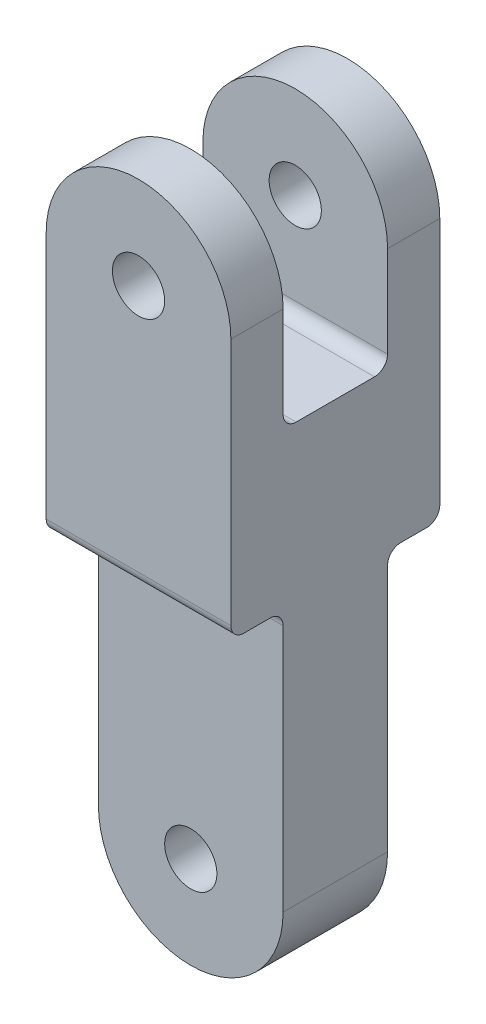
from build123d import *

# Parameters (mm, degrees)
BOSS_EXTRUDE1_DEPTH      = 40
BOSS_EXTRUDE1_DEPTH_BACK = 40
SKETCH1_R                = 10
CUT_EXTRUDE2_DEPTH       = 20
CUT_EXTRUDE2_DEPTH_BACK  = 20
CUT_EXTRUDE4_START       = -20
CUT_EXTRUDE4_DEPTH       = 20
CUT_EXTRUDE6_START       = -20
CUT_EXTRUDE6_DEPTH       = 20
FILLET3_R                = 5
SHELL1_START             = -15
SHELL1_OUTLINE_R         = 15
SHELL1_DEPTH             = 30
SHELL1_START_2           = -35
SHELL1_2_OUTLINE_W       = 60.710678118
SHELL1_2_OUTLINE_H       = 50
SHELL1_2_DEPTH           = 70
SHELL1_3_OUTLINE_R       = 15
SHELL1_3_DEPTH           = 10
SHELL1_START_3           = 25
SHELL1_4_OUTLINE_R       = 15
SHELL1_4_DEPTH           = 10
SHELL1_START_4           = -30.355339059
SHELL1_5_DEPTH           = 60.710678118


with BuildPart() as part:
    # Sketch1 → Boss-Extrude1 (new, two sides: drawn at the far end of the back side and taken through both)
    with BuildSketch(Plane.XY.offset(-BOSS_EXTRUDE1_DEPTH_BACK)):
        with BuildLine():
            Line((-35.355339059, 370), (-35.355339059, 570))
            ThreePointArc((-35.355339059, 570), (0, 605.355339059), (35.355339059, 570))
            Line((35.355339059, 570), (35.355339059, 370))
            ThreePointArc((35.355339059, 370), (0, 334.644660941), (-35.355339059, 370))
        make_face()
        with Locations(Location((0, 370, 0), (0, 0, 180))):
            Circle(SKETCH1_R, mode=Mode.SUBTRACT)
        with Locations(Location((0, 570, 0), (0, 0, 180))):
            Circle(SKETCH1_R, mode=Mode.SUBTRACT)
    extrude(amount=BOSS_EXTRUDE1_DEPTH + BOSS_EXTRUDE1_DEPTH_BACK)

    # Sketch2 → Cut-Extrude2 (cut, two sides: drawn at the far end of the back side and taken through both)
    with BuildSketch(Plane.XY.offset(-CUT_EXTRUDE2_DEPTH_BACK)):
        with BuildLine():
            Line((-35.355339059, 530), (35.355339059, 530))
            Line((35.355339059, 530), (35.355339059, 570))
            ThreePointArc((35.355339059, 570), (0, 605.355339059), (-35.355339059, 570))
            Line((-35.355339059, 570), (-35.355339059, 530))
        make_face()
    extrude(amount=CUT_EXTRUDE2_DEPTH + CUT_EXTRUDE2_DEPTH_BACK, mode=Mode.SUBTRACT)

    # Sketch3 → Cut-Extrude4 (cut)
    with BuildSketch(Plane.XY.offset(40).offset(CUT_EXTRUDE4_START)):
        with BuildLine():
            Line((-35.355339059, 370), (-35.355339059, 470))
            Line((-35.355339059, 470), (35.355339059, 470))
            Line((35.355339059, 470), (35.355339059, 370))
            ThreePointArc((35.355339059, 370), (0, 334.644660941), (-35.355339059, 370))
        make_face()
    extrude(amount=CUT_EXTRUDE4_DEPTH, mode=Mode.SUBTRACT)

    # Sketch5 → Cut-Extrude6 (cut)
    with BuildSketch(Plane(origin=(0, 0, -40), x_dir=(-1, 0, 0), z_dir=(0, 0, -1)).offset(CUT_EXTRUDE6_START)):
        with BuildLine():
            Line((-35.355339059, 370), (-35.355339059, 470))
            Line((-35.355339059, 470), (35.355339059, 470))
            Line((35.355339059, 470), (35.355339059, 370))
            ThreePointArc((35.355339059, 370), (0, 334.644660941), (-35.355339059, 370))
        make_face()
    extrude(amount=CUT_EXTRUDE6_DEPTH, mode=Mode.SUBTRACT)

    # Fillet3
    fillet3_edges = [part.edges().sort_by_distance(p)[0] for p in [
        (0, 530, -20),
        (0, 530, 20),
        (0, 470, 40),
        (0, 470, 20),
        (0, 470, -40),
        (0, 470, -20),
    ]]
    fillet(fillet3_edges, radius=FILLET3_R)

    # Shell1: read off the stored shape, not the designer's step
    # Shell1 outline → Shell1 (cut)
    with BuildSketch(Plane.XY.offset(SHELL1_START)):
        with BuildLine():
            ThreePointArc((-30.355339059, 370), (0, 339.644660941), (30.355339059, 370))
            Line((30.355339059, 370), (30.355339059, 525))
            Line((30.355339059, 525), (-30.355339059, 525))
            Line((-30.355339059, 525), (-30.355339059, 370))
        make_face()
        with Locations((0, 370)):
            Circle(SHELL1_OUTLINE_R, mode=Mode.SUBTRACT)
    extrude(amount=SHELL1_DEPTH, mode=Mode.SUBTRACT)

    # Shell1 2 outline → Shell1 2 (cut)
    with BuildSketch(Plane.XY.offset(SHELL1_START_2)):
        with Locations((0, 500)):
            Rectangle(SHELL1_2_OUTLINE_W, SHELL1_2_OUTLINE_H)
    extrude(amount=SHELL1_2_DEPTH, mode=Mode.SUBTRACT)

    # Shell1 3 outline → Shell1 3 (cut)
    with BuildSketch(Plane.XY.offset(SHELL1_START_2)):
        with BuildLine():
            Line((-30.355339059, 525), (30.355339059, 525))
            Line((30.355339059, 525), (30.355339059, 570))
            ThreePointArc((30.355339059, 570), (0, 600.355339059), (-30.355339059, 570))
            Line((-30.355339059, 570), (-30.355339059, 525))
        make_face()
        with Locations((0, 570)):
            Circle(SHELL1_3_OUTLINE_R, mode=Mode.SUBTRACT)
    extrude(amount=SHELL1_3_DEPTH, mode=Mode.SUBTRACT)

    # Shell1 4 outline → Shell1 4 (cut)
    with BuildSketch(Plane.XY.offset(SHELL1_START_3)):
        with BuildLine():
            Line((-30.355339059, 525), (30.355339059, 525))
            Line((30.355339059, 525), (30.355339059, 570))
            ThreePointArc((30.355339059, 570), (0, 600.355339059), (-30.355339059, 570))
            Line((-30.355339059, 570), (-30.355339059, 525))
        make_face()
        with Locations((0, 570)):
            Circle(SHELL1_4_OUTLINE_R, mode=Mode.SUBTRACT)
    extrude(amount=SHELL1_4_DEPTH, mode=Mode.SUBTRACT)

    # Shell1 5 outline → Shell1 5 (cut)
    with BuildSketch(Plane.YZ.offset(SHELL1_START_4)):
        with BuildLine():
            ThreePointArc((535, -25), (527.928932188, -22.071067812), (525, -15))
            Line((525, -15), (525, -25))
            Line((525, -25), (535, -25))
        make_face()
        with BuildLine():
            ThreePointArc((525, 15), (527.928932188, 22.071067812), (535, 25))
            Line((535, 25), (525, 25))
            Line((525, 25), (525, 15))
        make_face()
        with BuildLine():
            ThreePointArc((475, 25), (472.071067812, 17.928932188), (465, 15))
            Line((465, 15), (475, 15))
            Line((475, 15), (475, 25))
        make_face()
        with BuildLine():
            Line((475, -15), (465, -15))
            ThreePointArc((465, -15), (472.071067812, -17.928932188), (475, -25))
            Line((475, -25), (475, -15))
        make_face()
    extrude(amount=SHELL1_5_DEPTH, mode=Mode.SUBTRACT)


solid = part.part
